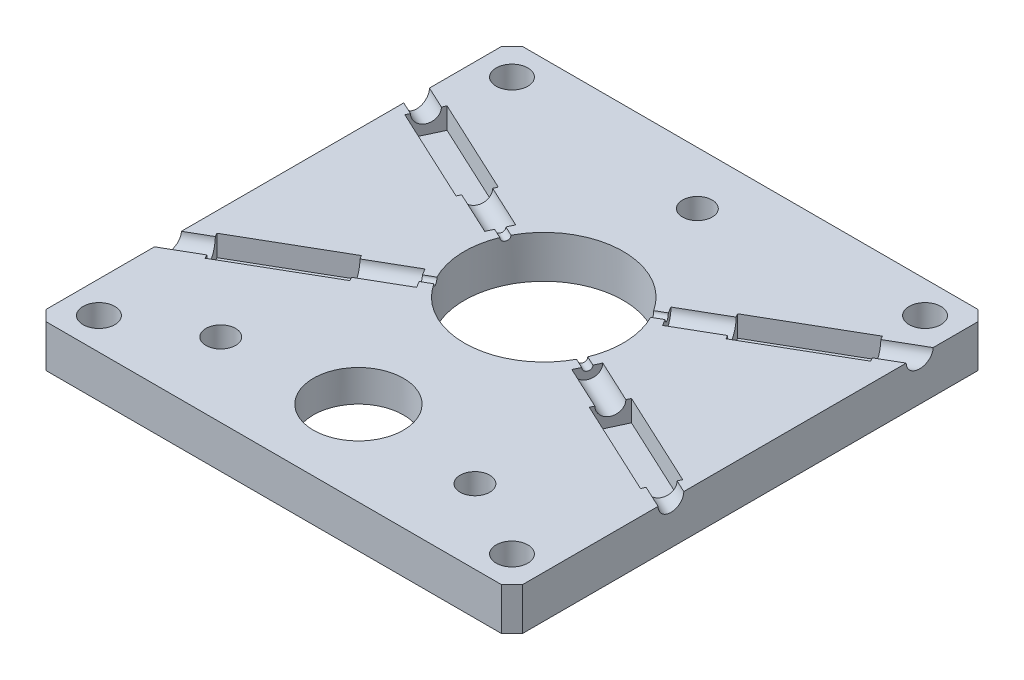
from build123d import *

# Parameters (mm, degrees)
SKETCH_1_W               = 45
SKETCH_1_H               = 45
EXTRUDE_1_DEPTH          = 4
SKETCH_2_R               = 7.5
CUT_EXTRUDE_1_DEPTH      = 33.070235422
CUT_EXTRUDE_START        = -4.5
SKETCH_4_R               = 1.1
CUT_EXTRUDE_3_DEPTH      = 51.888424881
SKETCH_10_R              = 0.4
CUT_EXTRUDE_9_DEPTH      = 2
SKETCH_7_R               = 1.1
CUT_EXTRUDE_5_DEPTH      = 52.18645266
SKETCH_11_R              = 0.4
CUT_EXTRUDE_10_DEPTH     = 2
CUT_EXTRUDE_4_DEPTH      = 2
PATTERN_CIRCULAR_1_COUNT = 2
SKETCH_6_R               = 1.5
CUT_EXTRUDE_6_DEPTH      = 33.070235434
SKETCH_8_R               = 4.25
CUT_EXTRUDE_7_DEPTH      = 33.070235434
SKETCH_9_R               = 6
CUT_EXTRUDE_8_DEPTH      = 1
SKETCH_12_R              = 1.4
CUT_EXTRUDE_11_DEPTH     = 33.070235434
CHAMFER_1_SIZE           = 1
CHAMFER_2_SIZE           = 1
CHAMFER_3_SIZE           = 2


with BuildPart() as part:
    # 草图1 → 凸台-拉伸1 (new body)
    with BuildSketch(Plane(origin=(0, 0, 0), x_dir=(1, 0, 0), z_dir=(0, 1, 0))):
        Rectangle(SKETCH_1_W, SKETCH_1_H)
    extrude(amount=EXTRUDE_1_DEPTH)

    # 草图2 → 切除-拉伸1 (cut, through all)
    with BuildSketch(Plane(origin=(0, 4, 0), x_dir=(1, 0, 0), z_dir=(0, 1, 0))):
        with Locations(Location((0, 3, 0), (0, 0, 270))):
            Circle(SKETCH_2_R)
    extrude(amount=-CUT_EXTRUDE_1_DEPTH, mode=Mode.SUBTRACT)

    # 草图4 → 切除-拉伸3 (cut)
    with BuildSketch(Plane(origin=(-11.782001231, 4, -8.494037403), x_dir=(-0.4226182617407036, 0, 0.9063077870366482), z_dir=(-0.9063077870366482, 0, -0.4226182617407036)).offset(CUT_EXTRUDE_START)):
        Circle(SKETCH_4_R)
    cut_extrude_3 = extrude(amount=CUT_EXTRUDE_3_DEPTH, mode=Mode.SUBTRACT)

    # 草图10 → 切除-拉伸9 (cut)
    with BuildSketch(Plane(origin=(-8.852682854, 0, -4.12807381), x_dir=(-0.4226182617407035, 0, 0.906307787036648), z_dir=(-0.906307787036648, 0, -0.4226182617407035))):
        with Locations((-2.718923361, 4)):
            Circle(SKETCH_10_R)
    cut_extrude_9 = extrude(amount=-CUT_EXTRUDE_9_DEPTH, mode=Mode.SUBTRACT)

    # 草图7 → 切除-拉伸5 (cut)
    with BuildSketch(Plane(origin=(11.258330249, 4, -9.5), x_dir=(-0.5000000000000042, 0, -0.8660254037844363), z_dir=(0.8660254037844363, 0, -0.5000000000000042)).offset(CUT_EXTRUDE_START)):
        Circle(SKETCH_7_R)
    cut_extrude_5 = extrude(amount=CUT_EXTRUDE_5_DEPTH, mode=Mode.SUBTRACT)

    # 草图11 → 切除-拉伸10 (cut)
    with BuildSketch(Plane(origin=(8.660254038, 0, -5), x_dir=(-0.5000000000000042, 0, -0.8660254037844363), z_dir=(0.8660254037844363, 0, -0.5000000000000042))):
        with Locations((2.598076211, 4)):
            Circle(SKETCH_11_R)
    cut_extrude_10 = extrude(amount=-CUT_EXTRUDE_10_DEPTH, mode=Mode.SUBTRACT)

    # 草图5 → 切除-拉伸4 (cut)
    with BuildSketch(Plane(origin=(0, 4, 0), x_dir=(1, 0, 0), z_dir=(0, 1, 0))):
        Polygon((-11.782001231, 8.494037403), (-12.246881319, 7.497098837), (-12.415928624, 7.134575722), (-21.479006494, 11.360758339), (-20.211151709, 14.079681701), (-11.148073839, 9.853499083), (-11.317121144, 9.490975968), align=None)
        Polygon((12.008330249, 8.200961894), (10.508330249, 10.799038106), (19.168584287, 15.799038106), (20.668584287, 13.200961894), align=None)
    cut_extrude_4 = extrude(amount=-CUT_EXTRUDE_4_DEPTH, mode=Mode.SUBTRACT)

    # 阵列(圆周)1: 切除-拉伸3, 切除-拉伸9, 切除-拉伸5, 切除-拉伸10, 切除-拉伸4 ×2 about axis
    pattern_circular_1_axis = Axis((0, 0, -3), (0, 1, 0))
    add([cut_extrude_3.rotate(pattern_circular_1_axis, i * 360 / PATTERN_CIRCULAR_1_COUNT) for i in range(1, PATTERN_CIRCULAR_1_COUNT)], mode=Mode.SUBTRACT)
    add([cut_extrude_9.rotate(pattern_circular_1_axis, i * 360 / PATTERN_CIRCULAR_1_COUNT) for i in range(1, PATTERN_CIRCULAR_1_COUNT)], mode=Mode.SUBTRACT)
    add([cut_extrude_5.rotate(pattern_circular_1_axis, i * 360 / PATTERN_CIRCULAR_1_COUNT) for i in range(1, PATTERN_CIRCULAR_1_COUNT)], mode=Mode.SUBTRACT)
    add([cut_extrude_10.rotate(pattern_circular_1_axis, i * 360 / PATTERN_CIRCULAR_1_COUNT) for i in range(1, PATTERN_CIRCULAR_1_COUNT)], mode=Mode.SUBTRACT)
    add([cut_extrude_4.rotate(pattern_circular_1_axis, i * 360 / PATTERN_CIRCULAR_1_COUNT) for i in range(1, PATTERN_CIRCULAR_1_COUNT)], mode=Mode.SUBTRACT)

    # 草图6 → 切除-拉伸6 (cut, through all)
    with BuildSketch(Plane.XZ):
        with Locations(Location((19.5, -19.5, 0), (0, 0, 270))):
            Circle(SKETCH_6_R)
        with Locations(Location((-19.5, -19.5, 0), (0, 0, 270))):
            Circle(SKETCH_6_R)
        with Locations(Location((-19.5, 19.5, 0), (0, 0, 270))):
            Circle(SKETCH_6_R)
        with Locations(Location((19.5, 19.5, 0), (0, 0, 270))):
            Circle(SKETCH_6_R)
    extrude(amount=-CUT_EXTRUDE_6_DEPTH, mode=Mode.SUBTRACT)

    # 草图8 → 切除-拉伸7 (cut, through all)
    with BuildSketch(Plane(origin=(0, 4, 0), x_dir=(1, 0, 0), z_dir=(0, 1, 0))):
        with Locations(Location((0, -14.5, 0), (0, 0, 270))):
            Circle(SKETCH_8_R)
    extrude(amount=-CUT_EXTRUDE_7_DEPTH, mode=Mode.SUBTRACT)

    # 草图9 → 切除-拉伸8 (cut)
    with BuildSketch(Plane.XZ):
        with Locations(Location((0, 14.5, 0), (0, 0, 270))):
            Circle(SKETCH_9_R)
    extrude(amount=-CUT_EXTRUDE_8_DEPTH, mode=Mode.SUBTRACT)

    # 草图12 → 切除-拉伸11 (cut, through all)
    with BuildSketch(Plane(origin=(0, 0, 0), x_dir=(1, 0, 0), z_dir=(0, 1, 0))):
        with Locations(Location((0, 17.5, 0), (0, 0, 90))):
            Circle(SKETCH_12_R)
        with Locations(Location((-12, -15.5, 0), (0, 0, 90))):
            Circle(SKETCH_12_R)
        with Locations(Location((12, -15.5, 0), (0, 0, 90))):
            Circle(SKETCH_12_R)
    extrude(amount=CUT_EXTRUDE_11_DEPTH, mode=Mode.SUBTRACT)

    # 倒角1
    chamfer_1_edges = [part.edges().sort_by_distance(p)[0] for p in [
        (0, 1, 20.5),
    ]]
    chamfer(chamfer_1_edges, length=CHAMFER_1_SIZE - 0.0001)  # a hair under: the kernel refuses the full size

    # 倒角2
    chamfer_2_edges = [part.edges().sort_by_distance(p)[0] for p in [
        (22.5, 2, 22.5),
        (-22.5, 2, 22.5),
        (-22.5, 2, -22.5),
        (22.5, 2, -22.5),
    ]]
    chamfer(chamfer_2_edges, length=CHAMFER_2_SIZE)

    # 倒角3
    chamfer_3_edges = [part.edges().sort_by_distance(p)[0] for p in [
        (0, 0, -16.1),
        (-12, 0, 16.9),
        (12, 0, 16.9),
    ]]
    chamfer(chamfer_3_edges, length=CHAMFER_3_SIZE)


solid = part.part
